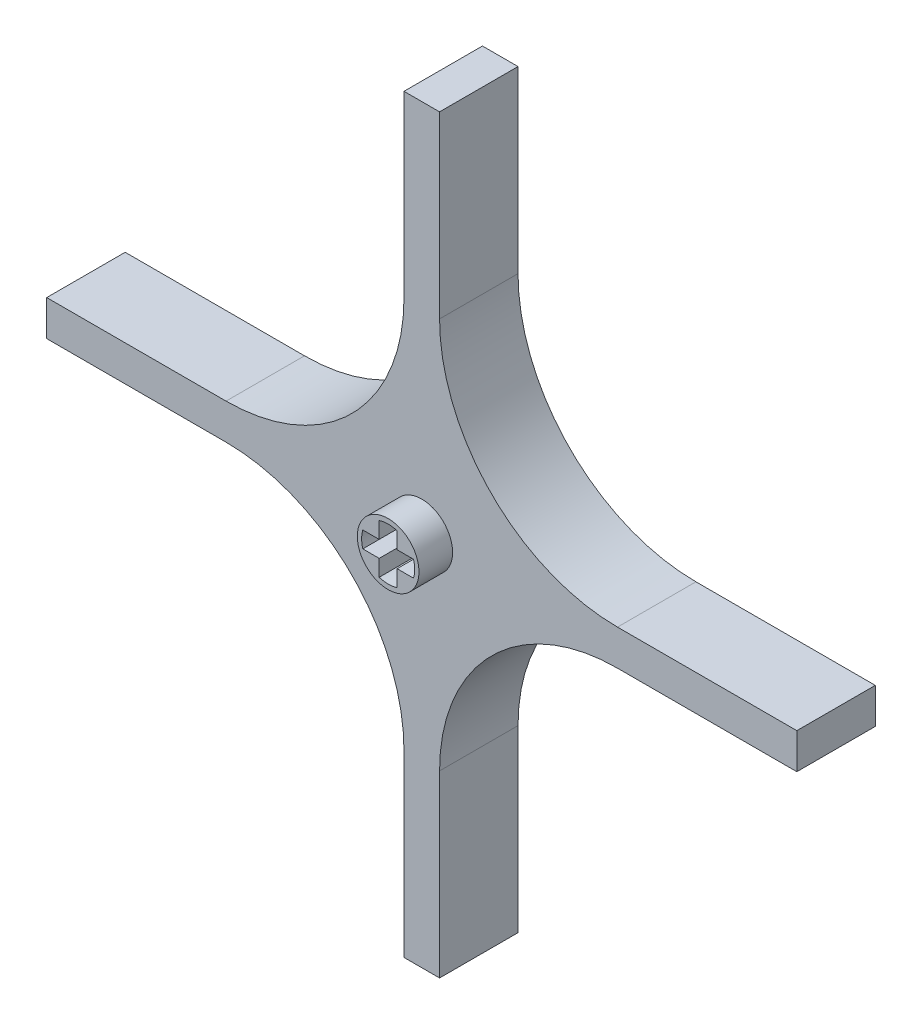
from build123d import *

# Parameters (mm, degrees)
BOSS_EXTRUDE1_DEPTH      = 3.5
FILLET1_R                = 15.875
BOSS_EXTRUDE2_DEPTH      = 3
BOSS_EXTRUDE2_DEPTH_BACK = 9.99999997
SKETCH3_R                = 2.75
CUT_EXTRUDE1_DEPTH       = 50.078972277


with BuildPart() as part:
    # Sketch1 → Boss-Extrude1 (new, symmetric)
    with BuildSketch(Plane.XY):
        Polygon((1.5875, -1.5875), (1.5875, -33.4645), (-1.5875, -33.4645), (-1.5875, -1.5875), (-33.4645, -1.5875), (-33.4645, 1.5875), (-1.5875, 1.5875), (-1.5875, 33.4645), (1.5875, 33.4645), (1.5875, 1.5875), (33.4645, 1.5875), (33.4645, -1.5875), align=None)
    extrude(amount=BOSS_EXTRUDE1_DEPTH, both=True)

    # Fillet1
    fillet1_edges = [part.edges().sort_by_distance(p)[0] for p in [
        (-1.5875, -1.5875, 0),
        (-1.5875, 1.5875, 0),
        (1.5875, -1.5875, 0),
        (1.5875, 1.5875, 0),
    ]]
    fillet(fillet1_edges, radius=FILLET1_R)

    # Sketch3 → Boss-Extrude2 (add, two sides: drawn at the far end of the back side and taken through both)
    with BuildSketch(Plane(origin=(0, 0, -3.5), x_dir=(-1, 0, 0), z_dir=(0, 0, -1)).offset(-BOSS_EXTRUDE2_DEPTH_BACK)):
        Circle(SKETCH3_R)
    extrude(amount=BOSS_EXTRUDE2_DEPTH + BOSS_EXTRUDE2_DEPTH_BACK)

    # Sketch4 → Cut-Extrude1 (cut, through all)
    with BuildSketch(Plane(origin=(0, 0, -6.5), x_dir=(-1, 0, 0), z_dir=(0, 0, -1))):
        with BuildLine():
            Line((-0.8, 2.19411255), (-0.8, 0.73137085))
            Line((-0.8, 0.73137085), (-2.2627417, 0.73137085))
            ThreePointArc((-2.2627417, 0.73137085), (-2.367727335, 0), (-2.2627417, -0.73137085))
            Line((-2.2627417, -0.73137085), (-0.8, -0.73137085))
            Line((-0.8, -0.73137085), (-0.8, -2.19411255))
            ThreePointArc((-0.8, -2.19411255), (0, -2.320249175), (0.8, -2.19411255))
            Line((0.8, -2.19411255), (0.8, -0.73137085))
            Line((0.8, -0.73137085), (2.2627417, -0.73137085))
            ThreePointArc((2.2627417, -0.73137085), (2.367727335, 0), (2.2627417, 0.73137085))
            Line((2.2627417, 0.73137085), (0.8, 0.73137085))
            Line((0.8, 0.73137085), (0.8, 2.19411255))
            ThreePointArc((0.8, 2.19411255), (0, 2.320249175), (-0.8, 2.19411255))
        make_face()
    extrude(amount=-CUT_EXTRUDE1_DEPTH, mode=Mode.SUBTRACT)


solid = part.part
